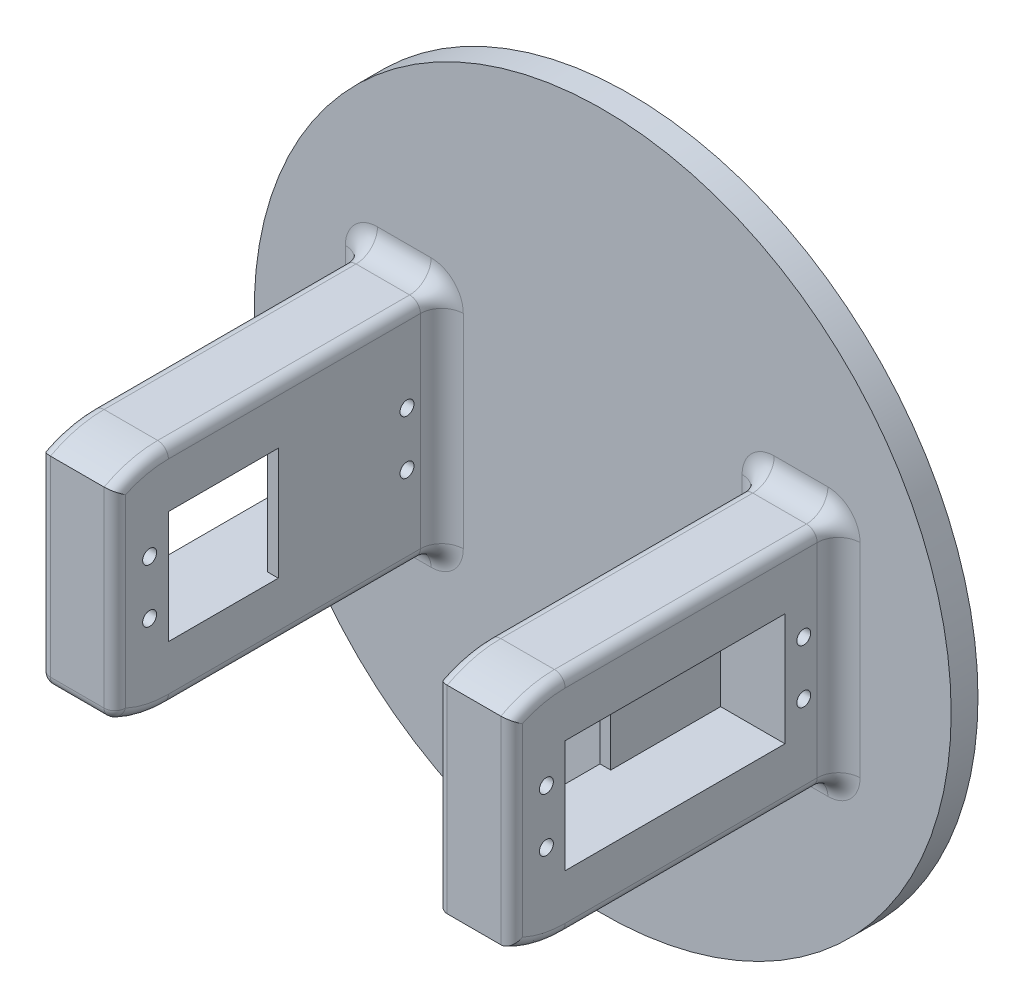
from build123d import *

# Parameters (mm, degrees)
SKETCH1_R           = 65
BOSS_EXTRUDE1_DEPTH = 5
SKETCH2_W           = 14
SKETCH2_H           = 70
BOSS_EXTRUDE2_DEPTH = 70
SKETCH4_W           = 41
SKETCH4_H           = 21
CUT_EXTRUDE1_DEPTH  = 12
CUT_EXTRUDE2_REACH  = 149.414
FILLET1_R           = 2
FILLET2_R           = 4
FILLET3_R           = 2
FILLET4_R           = 4
CUT_EXTRUDE3_REACH  = 145.045
SKETCH7_R           = 1.3
CUT_EXTRUDE4_REACH  = 136.127
SKETCH8_W           = 20.5
SKETCH8_H           = 21


with BuildPart() as part:
    # Sketch1 → Boss-Extrude1 (new body)
    with BuildSketch(Plane.XY):
        Circle(SKETCH1_R)
    extrude(amount=BOSS_EXTRUDE1_DEPTH)

    # Sketch2 → Boss-Extrude2 (add)
    with BuildSketch(Plane.XY.offset(5)):
        with Locations((-37, 0)):
            Rectangle(SKETCH2_W, SKETCH2_H)
        with Locations((37, 0)):
            Rectangle(SKETCH2_W, SKETCH2_H)
    extrude(amount=BOSS_EXTRUDE2_DEPTH)

    # Sketch4 → Cut-Extrude1 (cut)
    with BuildSketch(Plane.ZY.offset(44)):
        with Locations((35.5, 0)):
            Rectangle(SKETCH4_W, SKETCH4_H)
    cut_extrude1 = extrude(amount=-CUT_EXTRUDE1_DEPTH, mode=Mode.SUBTRACT)

    # Sketch5 → Cut-Extrude2 (cut, up to next)
    with BuildSketch(Plane.ZY.offset(44), mode=Mode.PRIVATE) as cut_extrude2_sk1:
        with BuildLine():
            Line((5, 35), (5, 21))
            Line((5, 21), (56, 21))
            ThreePointArc((56, 21), (61.158008745, 20.356692899), (66, 18.466185313))
            Line((66, 18.466185313), (66, -18.466185313))
            ThreePointArc((66, -18.466185313), (61.158008745, -20.356692899), (56, -21))
            Line((56, -21), (5, -21))
            Line((5, -21), (5, -35))
            Line((5, -35), (75, -35))
            Line((75, -35), (75, 35))
            Line((75, 35), (5, 35))
        make_face()
    cut_extrude2_tool1 = extrude(cut_extrude2_sk1.sketch, amount=-CUT_EXTRUDE2_REACH, mode=Mode.PRIVATE) & part.part
    cut_extrude2 = cut_extrude2_tool1.solids().sort_by_distance((-44, 28, 5.989949))[0]
    add(cut_extrude2, mode=Mode.SUBTRACT)

    # Fillet1
    fillet1_edges = [part.edges().sort_by_distance(p)[0] for p in [
        (-30, 20.356692899, 61.158008745),
        (-30, -20.356692899, 61.158008745),
        (-44, -20.356692899, 61.158008745),
        (-44, 21, 30.5),
        (-30, 0, 66),
        (-30, 21, 30.5),
        (-30, -21, 30.5),
        (-44, -21, 30.5),
        (-44, 20.356692899, 61.158008745),
        (-37, -18.466185313, 66),
        (-44, 0, 66),
    ]]
    fillet(fillet1_edges, radius=FILLET1_R)

    # Fillet2
    fillet2_edges = [part.edges().sort_by_distance(p)[0] for p in [
        (-43.414213562, 20.414213562, 5),
        (-37, 21, 5),
        (-30.585786438, 20.414213562, 5),
        (-30, 0, 5),
        (-30.585786438, -20.414213562, 5),
        (-37, -21, 5),
        (-43.414213562, -20.414213562, 5),
        (-44, 0, 5),
    ]]
    fillet(fillet2_edges, radius=FILLET2_R)

    # Mirror2: Cut-Extrude1 across plane
    add(cut_extrude1.mirror(Plane(origin=(0, 0, 0), x_dir=(0, 0, 1), z_dir=(1, 0, 0))), mode=Mode.SUBTRACT)

    # Mirror3: Cut-Extrude2 across plane
    add(cut_extrude2.mirror(Plane(origin=(0, 0, 0), x_dir=(0, 0, 1), z_dir=(1, 0, 0))), mode=Mode.SUBTRACT)

    # Fillet3
    fillet3_edges = [part.edges().sort_by_distance(p)[0] for p in [
        (30, 20.356692899, 61.158008745),
        (30, -20.356692899, 61.158008745),
        (44, 20.356692899, 61.158008745),
        (44, -20.356692899, 61.158008745),
        (30, 21, 30.5),
        (30, -21, 30.5),
        (30, 0, 66),
        (44, 21, 30.5),
        (44, 0, 66),
        (44, -21, 30.5),
    ]]
    fillet(fillet3_edges, radius=FILLET3_R)

    # Fillet4
    fillet4_edges = [part.edges().sort_by_distance(p)[0] for p in [
        (43.414213562, -20.414213562, 5),
        (37, -21, 5),
        (30.585786438, -20.414213562, 5),
        (30, 0, 5),
        (30.585786438, 20.414213562, 5),
        (37, 21, 5),
        (43.414213562, 20.414213562, 5),
        (44, 0, 5),
    ]]
    fillet(fillet4_edges, radius=FILLET4_R)

    # Sketch7 → Cut-Extrude3 (cut, up to next)
    with BuildSketch(Plane.ZY.offset(44), mode=Mode.PRIVATE) as cut_extrude3_sk1:
        with Locations((59.5, 5)):
            Circle(SKETCH7_R)
    cut_extrude3_tool1 = extrude(cut_extrude3_sk1.sketch, amount=-CUT_EXTRUDE3_REACH, mode=Mode.PRIVATE) & part.part
    # Sketch7 → Cut-Extrude3 (cut, up to next)
    with BuildSketch(Plane.ZY.offset(44), mode=Mode.PRIVATE) as cut_extrude3_sk2:
        with Locations((59.5, -5)):
            Circle(SKETCH7_R)
    cut_extrude3_tool2 = extrude(cut_extrude3_sk2.sketch, amount=-CUT_EXTRUDE3_REACH, mode=Mode.PRIVATE) & part.part
    # Sketch7 → Cut-Extrude3 (cut, up to next)
    with BuildSketch(Plane.ZY.offset(44), mode=Mode.PRIVATE) as cut_extrude3_sk3:
        with Locations((11.5, -5)):
            Circle(SKETCH7_R)
    cut_extrude3_tool3 = extrude(cut_extrude3_sk3.sketch, amount=-CUT_EXTRUDE3_REACH, mode=Mode.PRIVATE) & part.part
    # Sketch7 → Cut-Extrude3 (cut, up to next)
    with BuildSketch(Plane.ZY.offset(44), mode=Mode.PRIVATE) as cut_extrude3_sk4:
        with Locations((11.5, 5)):
            Circle(SKETCH7_R)
    cut_extrude3_tool4 = extrude(cut_extrude3_sk4.sketch, amount=-CUT_EXTRUDE3_REACH, mode=Mode.PRIVATE) & part.part
    cut_extrude3_1 = cut_extrude3_tool1.solids().sort_by_distance((-44, 5, 59.5))[0]
    add(cut_extrude3_1, mode=Mode.SUBTRACT)
    cut_extrude3_2 = cut_extrude3_tool2.solids().sort_by_distance((-44, -5, 59.5))[0]
    add(cut_extrude3_2, mode=Mode.SUBTRACT)
    cut_extrude3_3 = cut_extrude3_tool3.solids().sort_by_distance((-44, -5, 11.5))[0]
    add(cut_extrude3_3, mode=Mode.SUBTRACT)
    cut_extrude3_4 = cut_extrude3_tool4.solids().sort_by_distance((-44, 5, 11.5))[0]
    add(cut_extrude3_4, mode=Mode.SUBTRACT)
    cut_extrude3 = cut_extrude3_1 + cut_extrude3_2 + cut_extrude3_3 + cut_extrude3_4  # Cut-Extrude3 as one shape, for the pattern or mirror that repeats it

    # Mirror6: Cut-Extrude3 across plane
    add(cut_extrude3.mirror(Plane(origin=(0, 0, 0), x_dir=(0, 0, 1), z_dir=(1, 0, 0))), mode=Mode.SUBTRACT)

    # Sketch8 → Cut-Extrude4 (cut, up to next)
    with BuildSketch(Plane.ZY.offset(32), mode=Mode.PRIVATE) as cut_extrude4_sk1:
        with Locations((45.75, 0)):
            Rectangle(SKETCH8_W, SKETCH8_H)
    cut_extrude4_tool1 = extrude(cut_extrude4_sk1.sketch, amount=-CUT_EXTRUDE4_REACH, mode=Mode.PRIVATE) & part.part
    cut_extrude4 = cut_extrude4_tool1.solids().sort_by_distance((-32, 0, 45.75))[0]
    add(cut_extrude4, mode=Mode.SUBTRACT)

    # Mirror7: Cut-Extrude4 across plane
    add(cut_extrude4.mirror(Plane(origin=(0, 0, 0), x_dir=(0, 0, 1), z_dir=(1, 0, 0))), mode=Mode.SUBTRACT)


solid = part.part
